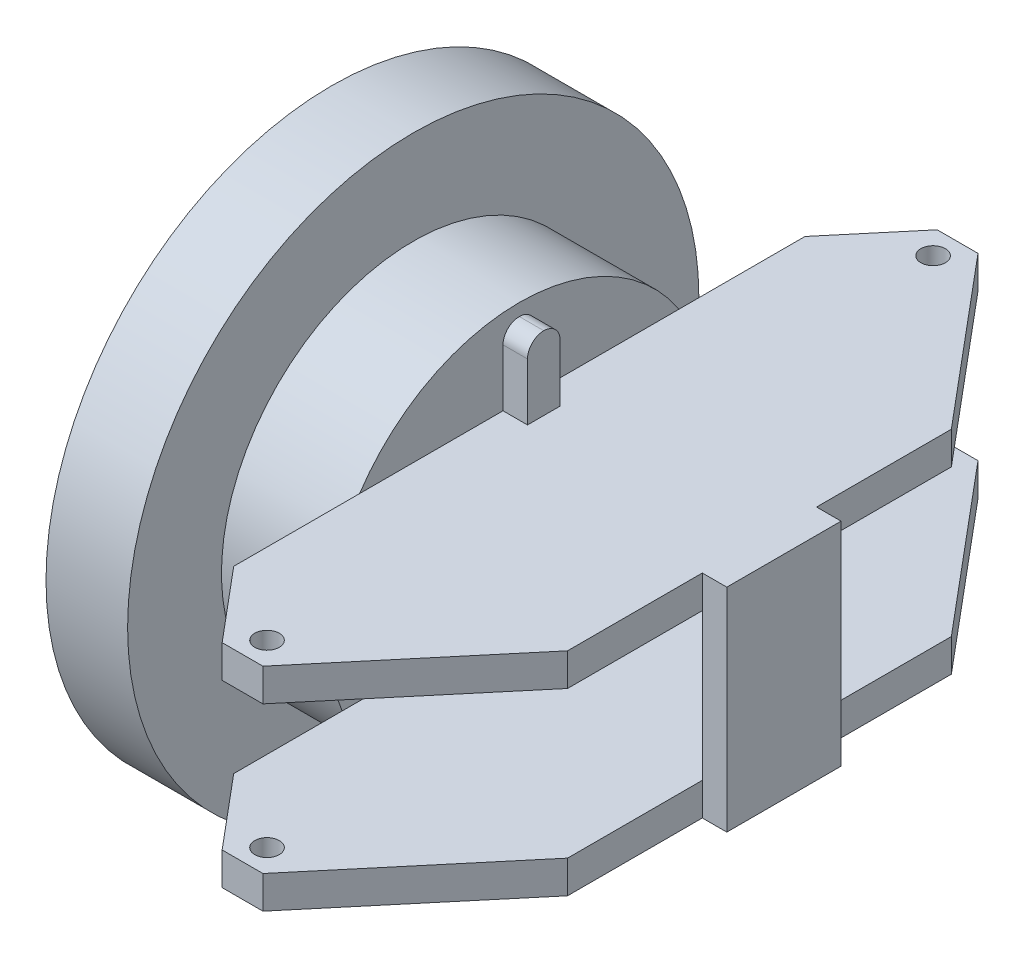
from build123d import *

# Parameters (mm, degrees)
SKETCH1_R               = 35
BOSS_EXTRUDE1_DEPTH     = 10
SKETCH2_R               = 23.5
BOSS_EXTRUDE2_DEPTH     = 13
BOSS_EXTRUDE3_DEPTH     = 4
SKETCH5_R               = 1.5
CUT_EXTRUDE1_DEPTH      = 4
MIRROR3_COPY_1_SKETCH_R = 1.5
MIRROR3_COPY_1_DEPTH    = 4
BOSS_EXTRUDE4_DEPTH     = 3
FILLET1_R               = 2
FILLET1_OF_MIRROR5_R    = 2
SKETCH8_W               = 14
SKETCH8_H               = 26
BOSS_EXTRUDE5_DEPTH     = 3
SKETCH9_R               = 10
CUT_EXTRUDE2_DEPTH      = 10


with BuildPart() as part:
    # Sketch1 → Boss-Extrude1 (new body)
    with BuildSketch(Plane(origin=(0, 0, 0), x_dir=(0, 0, -1), z_dir=(1, 0, 0))):
        Circle(SKETCH1_R)
    extrude(amount=BOSS_EXTRUDE1_DEPTH)

    # Sketch2 → Boss-Extrude2 (add)
    with BuildSketch(Plane(origin=(10, 0, 0), x_dir=(0, 0, -1), z_dir=(1, 0, 0))):
        with Locations(Location((0, 0, 0), (0, 0, 180))):
            Circle(SKETCH2_R)
    extrude(amount=BOSS_EXTRUDE2_DEPTH)

    # Sketch3 → Boss-Extrude3 (add)
    with BuildSketch(Plane(origin=(0, 13, 0), x_dir=(1, 0, 0), z_dir=(0, 1, 0))):
        Polygon((23, 35), (23, -35), (30.392057511, -43.809511096), (35.392057511, -43.809511096), (52.421803319, -23.514250349), (52.421803319, 0), (52.421803319, 23.514250349), (35.392057511, 43.809511096), (30.392057511, 43.809511096), align=None)
    boss_extrude3 = extrude(amount=-BOSS_EXTRUDE3_DEPTH)

    # Sketch5 → Cut-Extrude1 (cut)
    with BuildSketch(Plane(origin=(0, 13, 0), x_dir=(1, 0, 0), z_dir=(0, 1, 0))):
        with Locations(Location((32.892057511, -40.809511096, 0), (0, 0, 270))):
            Circle(SKETCH5_R)
    cut_extrude1 = extrude(amount=-CUT_EXTRUDE1_DEPTH, mode=Mode.SUBTRACT)

    # Mirror2: Cut-Extrude1 across plane
    add(cut_extrude1.mirror(Plane.XY), mode=Mode.SUBTRACT)

    # Mirror3: Boss-Extrude3, Cut-Extrude1 across plane
    add(boss_extrude3.mirror(Plane.ZX))
    add(cut_extrude1.mirror(Plane.ZX), mode=Mode.SUBTRACT)

    # Mirror3 copy 1 sketch → Mirror3 copy 1 (cut)
    with BuildSketch(Plane.XZ.offset(13)):
        with Locations(Location((32.892057511, -40.809511096, 0), (0, 0, 270))):
            Circle(MIRROR3_COPY_1_SKETCH_R)
    extrude(amount=-MIRROR3_COPY_1_DEPTH, mode=Mode.SUBTRACT)

    # Sketch7 → Boss-Extrude4 (add)
    with BuildSketch(Plane(origin=(23, 0, 0), x_dir=(0, 0, -1), z_dir=(1, 0, 0))):
        Polygon((0, 22), (-2, 22), (-2, 13), (2, 13), (2, 22), align=None)
    boss_extrude4 = extrude(amount=BOSS_EXTRUDE4_DEPTH)

    # Fillet1
    fillet1_edges = [part.edges().sort_by_distance(p)[0] for p in [
        (24.5, 22, 2),
        (24.5, 22, -2),
    ]]
    fillet(fillet1_edges, radius=FILLET1_R - 0.0001)  # a hair under: the kernel refuses the full size

    # Mirror5: Boss-Extrude4 across plane
    add(boss_extrude4.mirror(Plane.ZX))

    # Fillet1 of Mirror5
    fillet1_of_mirror5_edges = [part.edges().sort_by_distance(p)[0] for p in [
        (24.5, -22, 2),
        (24.5, -22, -2),
    ]]
    fillet(fillet1_of_mirror5_edges, radius=FILLET1_OF_MIRROR5_R - 0.0001)  # a hair under: the kernel refuses the full size

    # Sketch8 → Boss-Extrude5 (add)
    with BuildSketch(Plane(origin=(52.421803319, 0, 0), x_dir=(0, 0, -1), z_dir=(1, 0, 0))):
        Rectangle(SKETCH8_W, SKETCH8_H)
    extrude(amount=BOSS_EXTRUDE5_DEPTH)

    # Sketch9 → Cut-Extrude2 (cut)
    with BuildSketch(Plane.ZY):
        Circle(SKETCH9_R)
    extrude(amount=-CUT_EXTRUDE2_DEPTH, mode=Mode.SUBTRACT)


solid = part.part
